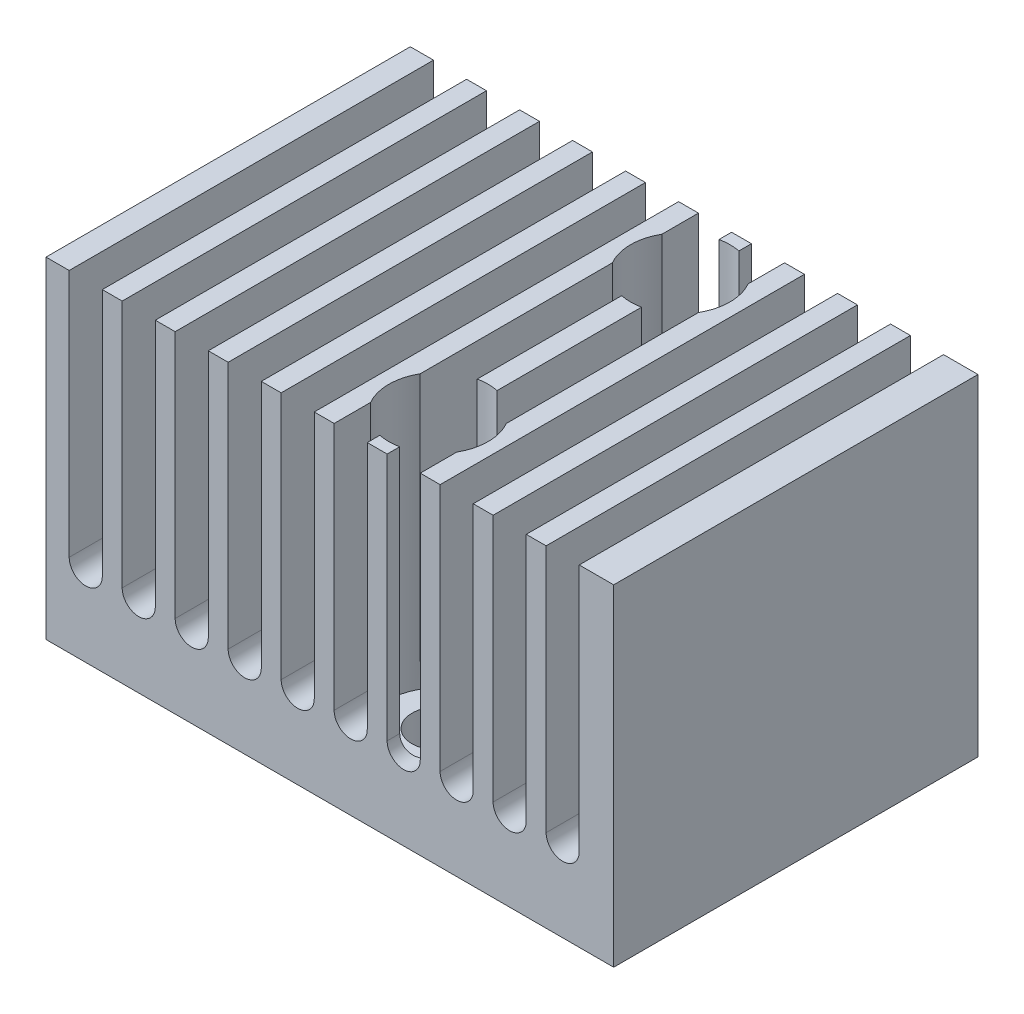
from build123d import *

# Parameters (mm, degrees)
SKETCH_1_W          = 17.14
SKETCH_1_H          = 11
EXTRUDE_1_DEPTH     = 10
CUT_EXTRUDE_1_DEPTH = 18.159396843
SKETCH_3_R          = 0.8
CUT_EXTRUDE_2_DEPTH = 1.75
SKETCH_4_R          = 1.5
CUT_EXTRUDE_3_DEPTH = 14.105624747


with BuildPart() as part:
    # 草图1 → 凸台-拉伸1 (new body)
    with BuildSketch(Plane(origin=(0, 0, 0), x_dir=(1, 0, 0), z_dir=(0, 1, 0))):
        Rectangle(SKETCH_1_W, SKETCH_1_H)
    extrude(amount=EXTRUDE_1_DEPTH)

    # 草图2 → 切除-拉伸1 (cut, through all)
    with BuildSketch(Plane.XY.offset(5.5)):
        with BuildLine():
            Line((7.53, 10), (6.53, 10))
            Line((6.53, 10), (6.53, 2.5))
            ThreePointArc((6.53, 2.5), (7.03, 2), (7.53, 2.5))
            Line((7.53, 2.5), (7.53, 10))
        make_face()
        with BuildLine():
            Line((5.93, 10), (4.93, 10))
            Line((4.93, 10), (4.93, 2.5))
            ThreePointArc((4.93, 2.5), (5.43, 2), (5.93, 2.5))
            Line((5.93, 2.5), (5.93, 10))
        make_face()
        with BuildLine():
            Line((4.33, 10), (3.33, 10))
            Line((3.33, 10), (3.33, 2.5))
            ThreePointArc((3.33, 2.5), (3.83, 2), (4.33, 2.5))
            Line((4.33, 2.5), (4.33, 10))
        make_face()
        with BuildLine():
            Line((2.73, 10), (1.73, 10))
            Line((1.73, 10), (1.73, 2.5))
            ThreePointArc((1.73, 2.5), (2.23, 2), (2.73, 2.5))
            Line((2.73, 2.5), (2.73, 10))
        make_face()
        with BuildLine():
            Line((1.13, 10), (0.13, 10))
            Line((0.13, 10), (0.13, 2.5))
            ThreePointArc((0.13, 2.5), (0.63, 2), (1.13, 2.5))
            Line((1.13, 2.5), (1.13, 10))
        make_face()
        with BuildLine():
            Line((-0.47, 10), (-1.47, 10))
            Line((-1.47, 10), (-1.47, 2.5))
            ThreePointArc((-1.47, 2.5), (-0.97, 2), (-0.47, 2.5))
            Line((-0.47, 2.5), (-0.47, 10))
        make_face()
        with BuildLine():
            Line((-2.07, 10), (-3.07, 10))
            Line((-3.07, 10), (-3.07, 2.5))
            ThreePointArc((-3.07, 2.5), (-2.57, 2), (-2.07, 2.5))
            Line((-2.07, 2.5), (-2.07, 10))
        make_face()
        with BuildLine():
            Line((-3.67, 10), (-4.67, 10))
            Line((-4.67, 10), (-4.67, 2.5))
            ThreePointArc((-4.67, 2.5), (-4.17, 2), (-3.67, 2.5))
            Line((-3.67, 2.5), (-3.67, 10))
        make_face()
        with BuildLine():
            Line((-5.27, 10), (-6.27, 10))
            Line((-6.27, 10), (-6.27, 2.5))
            ThreePointArc((-6.27, 2.5), (-5.77, 2), (-5.27, 2.5))
            Line((-5.27, 2.5), (-5.27, 10))
        make_face()
        with BuildLine():
            Line((-6.87, 10), (-7.87, 10))
            Line((-7.87, 10), (-7.87, 2.5))
            ThreePointArc((-7.87, 2.5), (-7.37, 2), (-6.87, 2.5))
            Line((-6.87, 2.5), (-6.87, 10))
        make_face()
    extrude(amount=-CUT_EXTRUDE_1_DEPTH, mode=Mode.SUBTRACT)

    # 草图3 → 切除-拉伸2 (cut)
    with BuildSketch(Plane.XZ):
        with Locations((1.43, 3.65)):
            Circle(SKETCH_3_R)
        with Locations((1.43, -3.65)):
            Circle(SKETCH_3_R)
    extrude(amount=-CUT_EXTRUDE_2_DEPTH, mode=Mode.SUBTRACT)

    # 草图4 → 切除-拉伸3 (cut, through all)
    with BuildSketch(Plane.XZ.offset(-1.75)):
        with Locations((1.43, 3.65)):
            Circle(SKETCH_4_R)
        with Locations((1.43, -3.65)):
            Circle(SKETCH_4_R)
    extrude(amount=-CUT_EXTRUDE_3_DEPTH, mode=Mode.SUBTRACT)


solid = part.part
